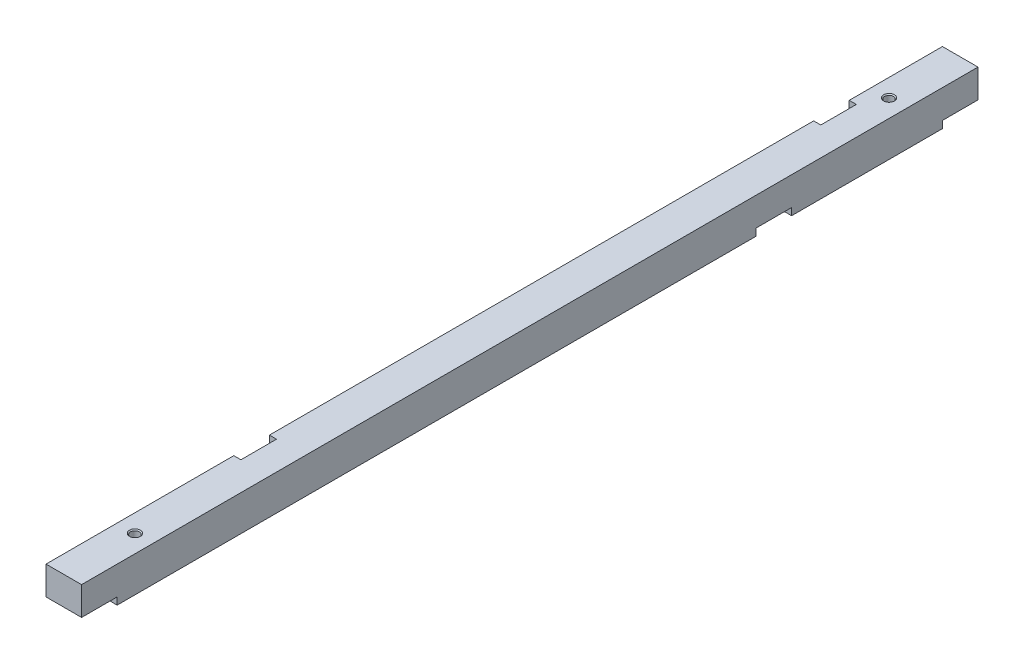
from build123d import *

# Parameters (mm, degrees)
ESQUISSE1_W                     = 10
ESQUISSE1_H                     = 10
BOSS_EXTRU_1_DEPTH              = 252
ESQUISSE2_W                     = 10
ESQUISSE2_H                     = 2
ENL_V_MAT_EXTRU_1_DEPTH         = 253.247893946
ESQUISSE5_W                     = 2
ESQUISSE5_H                     = 10
ENL_V_MAT_EXTRU_4_DEPTH         = 253.247893946
TROU_TARAUD_M3X0_51_D           = 2.5
TROU_TARAUD_M3X0_51_CSINK_D     = 3.05
TROU_TARAUD_M3X0_51_CSINK_ANGLE = 90


with BuildPart() as part:
    # Esquisse1 → Boss.-Extru.1 (new body)
    with BuildSketch(Plane.XY):
        Rectangle(ESQUISSE1_W, ESQUISSE1_H)
    extrude(amount=BOSS_EXTRU_1_DEPTH)

    # Esquisse2 → Enlèv. mat.-Extru.1 (cut, through all)
    with BuildSketch(Plane.ZY.offset(5)):
        with Locations((5, -4)):
            Rectangle(ESQUISSE2_W, ESQUISSE2_H)
        with Locations((57.4, -4)):
            Rectangle(ESQUISSE2_W, ESQUISSE2_H)
        with Locations((247, -4)):
            Rectangle(ESQUISSE2_W, ESQUISSE2_H)
    extrude(amount=-ENL_V_MAT_EXTRU_1_DEPTH, mode=Mode.SUBTRACT)

    # Esquisse5 → Enlèv. mat.-Extru.4 (cut, through all)
    with BuildSketch(Plane(origin=(0, 5, 0), x_dir=(1, 0, 0), z_dir=(0, 1, 0))):
        with Locations((-4, -194.2)):
            Rectangle(ESQUISSE5_W, ESQUISSE5_H)
        with Locations((-4, -31.2)):
            Rectangle(ESQUISSE5_W, ESQUISSE5_H)
    extrude(amount=-ENL_V_MAT_EXTRU_4_DEPTH, mode=Mode.SUBTRACT)

    # Trou taraudé M3x0.51 (through all)
    with Locations(Plane(origin=(0, 5, 0), x_dir=(1, 0, 0), z_dir=(0, 1, 0))):
        with Locations((0, -20), (0, -232)):
            CounterSinkHole(TROU_TARAUD_M3X0_51_D / 2, TROU_TARAUD_M3X0_51_CSINK_D / 2, counter_sink_angle=TROU_TARAUD_M3X0_51_CSINK_ANGLE)


solid = part.part
